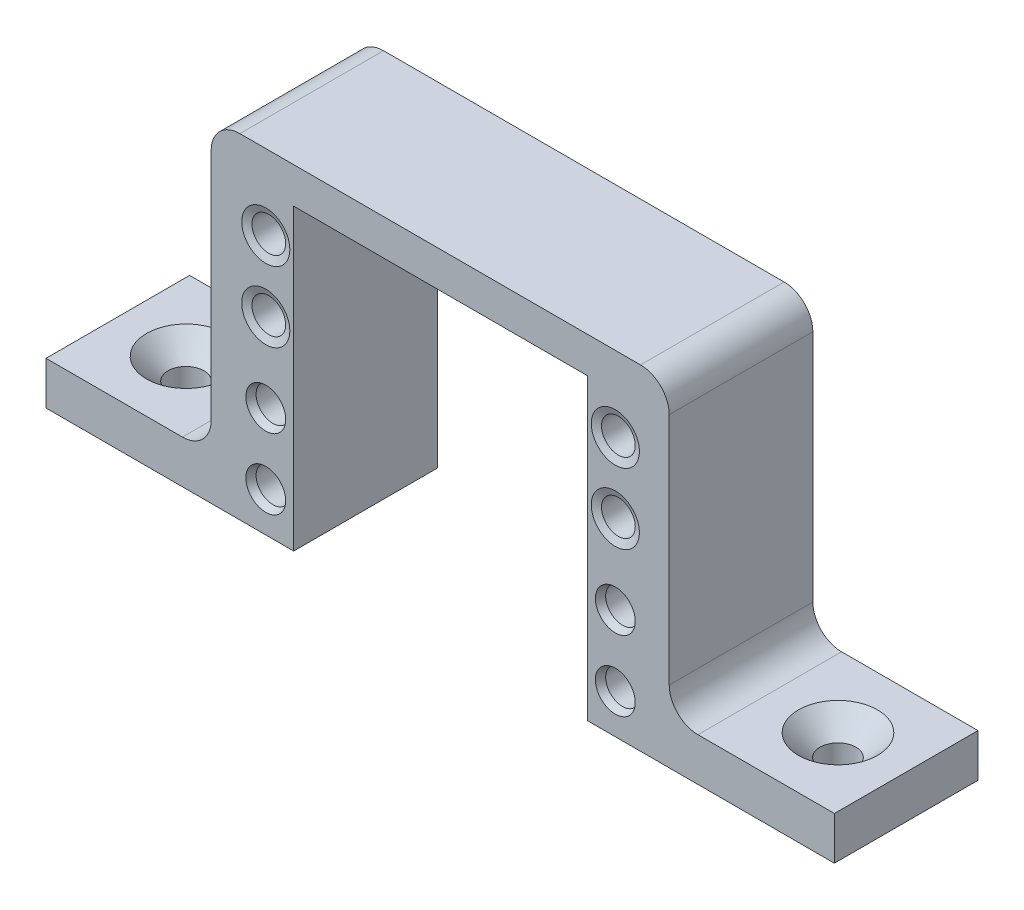
from build123d import *

# Parameters (mm, degrees)
SKETCH1_W             = 18.495
SKETCH1_H             = 20.8
SKETCH1_W_2           = 10
SKETCH1_W_3           = 37.395
BOSS_EXTRUDE1_DEPTH   = 20
SKETCH6_W             = 106.79
SKETCH6_H             = 20
BOSS_EXTRUDE4_DEPTH   = 5
SKETCH9_R             = 2.35
CUT_EXTRUDE1_DEPTH    = 10
SKETCH10_W            = 20
SKETCH10_H            = 25.8
CUT_EXTRUDE2_DEPTH    = 17
SKETCH11_W            = 20
SKETCH11_H            = 25.8
CUT_EXTRUDE3_DEPTH    = 26
CHAMFER1_SIZE         = 1
CHAMFER1_SIZE2        = 0.424474816
MIRROR1_2_OUTLINE_R   = 2.35
MIRROR1_2_OUTLINE_R_2 = 2.774474816
MIRROR1_2_DEPTH       = 20
MIRROR1_3_OUTLINE_R   = 2.35
MIRROR1_3_OUTLINE_R_2 = 2.774474816
MIRROR1_3_DEPTH       = 10
SKETCH12_W            = 63.79
SKETCH12_H            = 20
CUT_EXTRUDE4_DEPTH    = 5
SKETCH13_W            = 20
SKETCH13_H            = 6
BOSS_EXTRUDE5_DEPTH   = 23
FILLET2_R             = 4
SKETCH14_R            = 2.5
CUT_EXTRUDE5_DEPTH    = 6
CHAMFER2_SIZE         = 3


with BuildPart() as part:
    # Sketch1 → Boss-Extrude1 (new body)
    with BuildSketch(Plane.XY):
        with Locations((-39.1475, 0)):
            Rectangle(SKETCH1_W, SKETCH1_H)
        with Locations((-53.395, 0)):
            Rectangle(SKETCH1_W_2, SKETCH1_H)
        with Locations((29.6975, 0)):
            Rectangle(SKETCH1_W_3, SKETCH1_H)
    extrude(amount=BOSS_EXTRUDE1_DEPTH)

    # Sketch6 → Boss-Extrude4 (add)
    with BuildSketch(Plane(origin=(0, 10.4, 0), x_dir=(1, 0, 0), z_dir=(0, 1, 0))):
        with Locations((-5, -10)):
            Rectangle(SKETCH6_W, SKETCH6_H)
    extrude(amount=BOSS_EXTRUDE4_DEPTH)

    # Sketch9 → Cut-Extrude1 (cut)
    with BuildSketch(Plane.XY.offset(20)):
        with Locations((14.89, -4.9)):
            Circle(SKETCH9_R)
        with Locations(Location((14.89, 4.9, 0), (0, 0, 180))):
            Circle(SKETCH9_R)
        with Locations(Location((-33.79, -4.9, 0), (0, 0, 180))):
            Circle(SKETCH9_R)
        with Locations((-33.79, 4.9)):
            Circle(SKETCH9_R)
    extrude(amount=-CUT_EXTRUDE1_DEPTH, mode=Mode.SUBTRACT)

    # Sketch10 → Cut-Extrude2 (cut)
    with BuildSketch(Plane.ZY.offset(58.395)):
        with Locations((10, 2.5)):
            Rectangle(SKETCH10_W, SKETCH10_H)
    extrude(amount=-CUT_EXTRUDE2_DEPTH, mode=Mode.SUBTRACT)

    # Sketch11 → Cut-Extrude3 (cut)
    with BuildSketch(Plane(origin=(48.395, 0, 0), x_dir=(0, 0, -1), z_dir=(1, 0, 0))):
        with Locations((-10, 2.5)):
            Rectangle(SKETCH11_W, SKETCH11_H)
    extrude(amount=-CUT_EXTRUDE3_DEPTH, mode=Mode.SUBTRACT)

    # Chamfer1
    chamfer1_edges = [part.edges().sort_by_distance(p)[0] for p in [
        (17.24, 4.9, 20),
        (-31.44, -4.9, 20),
        (-36.14, 4.9, 20),
        (12.54, -4.9, 20),
    ]]
    chamfer1_side = [part.faces().sort_by_distance(p)[0] for p in [
        (-35.6475, -9.711900872, 20),
    ]]
    chamfer(chamfer1_edges, length=CHAMFER1_SIZE, length2=CHAMFER1_SIZE2, reference=chamfer1_side[0])



with BuildPart() as body_2:
    # Mirror1: read off the stored shape, not the designer's step
    # Mirror1 outline → Mirror1 (revolve)
    with BuildSketch(Plane(origin=(14.89, -25.7, 0), x_dir=(1, 0, 0), z_dir=(0, -1, 0))):
        Polygon((2.35, 19), (2.35, 10), (2.774474816, 10), (2.774474816, 20), align=None)
    revolve(axis=Axis((14.89, -25.7, 0), (0, 0, 1)))


with BuildPart() as part_1:
    add(part.part)

    add(body_2.part)  # Mirror1 2 merges body 2
    # Mirror1 2 outline → Mirror1 2 (add)
    with BuildSketch(Plane.XY):
        Polygon((-41.395, -10.4), (-41.395, -36.2), (22.395, -36.2), (22.395, -10.4), (11, -10.4), (11, -31.2), (-29.9, -31.2), (-29.9, -10.4), align=None)
        with Locations((-33.79, -25.7)):
            Circle(MIRROR1_2_OUTLINE_R, mode=Mode.SUBTRACT)
        with Locations((14.89, -25.7)):
            Circle(MIRROR1_2_OUTLINE_R_2, mode=Mode.SUBTRACT)
        with Locations((-33.79, -15.9)):
            Circle(MIRROR1_2_OUTLINE_R, mode=Mode.SUBTRACT)
        with Locations((14.89, -15.9)):
            Circle(MIRROR1_2_OUTLINE_R, mode=Mode.SUBTRACT)
    extrude(amount=MIRROR1_2_DEPTH)

    # Mirror1 3 outline → Mirror1 3 (add)
    with BuildSketch(Plane.XY):
        with Locations((14.89, -15.9)):
            Circle(MIRROR1_3_OUTLINE_R)
        with Locations((-33.79, -25.7)):
            Circle(MIRROR1_3_OUTLINE_R)
        with Locations((-33.79, -15.9)):
            Circle(MIRROR1_3_OUTLINE_R)
        with Locations((14.89, -25.7)):
            Circle(MIRROR1_3_OUTLINE_R_2)
    extrude(amount=MIRROR1_3_DEPTH)

    # Mirror1 4: loft between two sections, ruled curve by curve
    mirror1_4_from = [
        Edge.make_three_point_arc((17.24, -15.9, 19), (14.89, -13.55, 19), (12.54, -15.9, 19)),
        Edge.make_three_point_arc((12.54, -15.9, 19), (14.89, -18.25, 19), (17.24, -15.9, 19)),
    ]
    mirror1_4_to = [
        Edge.make_three_point_arc((17.664474816, -15.9, 20), (14.89, -13.125525184, 20), (12.115525184, -15.9, 20)),
        Edge.make_three_point_arc((12.115525184, -15.9, 20), (14.89, -18.674474816, 20), (17.664474816, -15.9, 20)),
    ]
    mirror1_4 = Solid(Shell([*[Face.make_surface_from_curves(mirror1_4_from[k], mirror1_4_to[k]) for k in range(2)], Face(Wire(mirror1_4_from)), Face(Wire(mirror1_4_to))]))
    add(mirror1_4, mode=Mode.SUBTRACT)

    # Mirror1 5: loft between two sections, ruled curve by curve
    mirror1_5_from = [
        Edge.make_three_point_arc((-31.44, -25.7, 19), (-33.79, -23.35, 19), (-36.14, -25.7, 19)),
        Edge.make_three_point_arc((-36.14, -25.7, 19), (-33.79, -28.05, 19), (-31.44, -25.7, 19)),
    ]
    mirror1_5_to = [
        Edge.make_three_point_arc((-31.015525184, -25.7, 20), (-33.79, -22.925525184, 20), (-36.564474816, -25.7, 20)),
        Edge.make_three_point_arc((-36.564474816, -25.7, 20), (-33.79, -28.474474816, 20), (-31.015525184, -25.7, 20)),
    ]
    mirror1_5 = Solid(Shell([*[Face.make_surface_from_curves(mirror1_5_from[k], mirror1_5_to[k]) for k in range(2)], Face(Wire(mirror1_5_from)), Face(Wire(mirror1_5_to))]))
    add(mirror1_5, mode=Mode.SUBTRACT)

    # Mirror1 6: loft between two sections, ruled curve by curve
    mirror1_6_from = [
        Edge.make_three_point_arc((-31.44, -15.9, 19), (-33.79, -13.55, 19), (-36.14, -15.9, 19)),
        Edge.make_three_point_arc((-36.14, -15.9, 19), (-33.79, -18.25, 19), (-31.44, -15.9, 19)),
    ]
    mirror1_6_to = [
        Edge.make_three_point_arc((-31.015525184, -15.9, 20), (-33.79, -13.125525184, 20), (-36.564474816, -15.9, 20)),
        Edge.make_three_point_arc((-36.564474816, -15.9, 20), (-33.79, -18.674474816, 20), (-31.015525184, -15.9, 20)),
    ]
    mirror1_6 = Solid(Shell([*[Face.make_surface_from_curves(mirror1_6_from[k], mirror1_6_to[k]) for k in range(2)], Face(Wire(mirror1_6_from)), Face(Wire(mirror1_6_to))]))
    add(mirror1_6, mode=Mode.SUBTRACT)

    # Sketch12 → Cut-Extrude4 (cut)
    with BuildSketch(Plane(origin=(0, -36.2, 0), x_dir=(-1, 0, 0), z_dir=(0, -1, 0))):
        with Locations((9.5, -10)):
            Rectangle(SKETCH12_W, SKETCH12_H)
    extrude(amount=-CUT_EXTRUDE4_DEPTH, mode=Mode.SUBTRACT)

    # Sketch13 → Boss-Extrude5 (add)
    with BuildSketch(Plane(origin=(22.395, 0, 0), x_dir=(0, 0, -1), z_dir=(1, 0, 0))):
        with Locations((-10, -28.2)):
            Rectangle(SKETCH13_W, SKETCH13_H)
    boss_extrude5 = extrude(amount=BOSS_EXTRUDE5_DEPTH)

    # Mirror2: Boss-Extrude5 across plane
    add(boss_extrude5.mirror(Plane(origin=(-9.5, 0, 0), x_dir=(0, 0, 1), z_dir=(1, 0, 0))))

    # Fillet2
    fillet2_edges = [part_1.edges().sort_by_distance(p)[0] for p in [
        (22.395, -25.2, 10),
        (-41.395, -25.2, 10),
        (-41.395, 15.4, 10),
        (22.395, 15.4, 10),
    ]]
    fillet(fillet2_edges, radius=FILLET2_R)

    # Sketch14 → Cut-Extrude5 (cut)
    with BuildSketch(Plane(origin=(0, -25.2, 0), x_dir=(1, 0, 0), z_dir=(0, 1, 0))):
        with Locations(Location((35.895, -10, 0), (0, 0, 270))):
            Circle(SKETCH14_R)
    cut_extrude5 = extrude(amount=-CUT_EXTRUDE5_DEPTH, mode=Mode.SUBTRACT)

    # Mirror5: Cut-Extrude5 across plane
    add(cut_extrude5.mirror(Plane(origin=(-9.5, 0, 0), x_dir=(0, 0, 1), z_dir=(1, 0, 0))), mode=Mode.SUBTRACT)

    # Chamfer2
    chamfer2_edges = [part_1.edges().sort_by_distance(p)[0] for p in [
        (35.895, -25.2, 7.5),
        (-54.895, -25.2, 7.5),
    ]]
    chamfer(chamfer2_edges, length=CHAMFER2_SIZE)


solid = part_1.part
